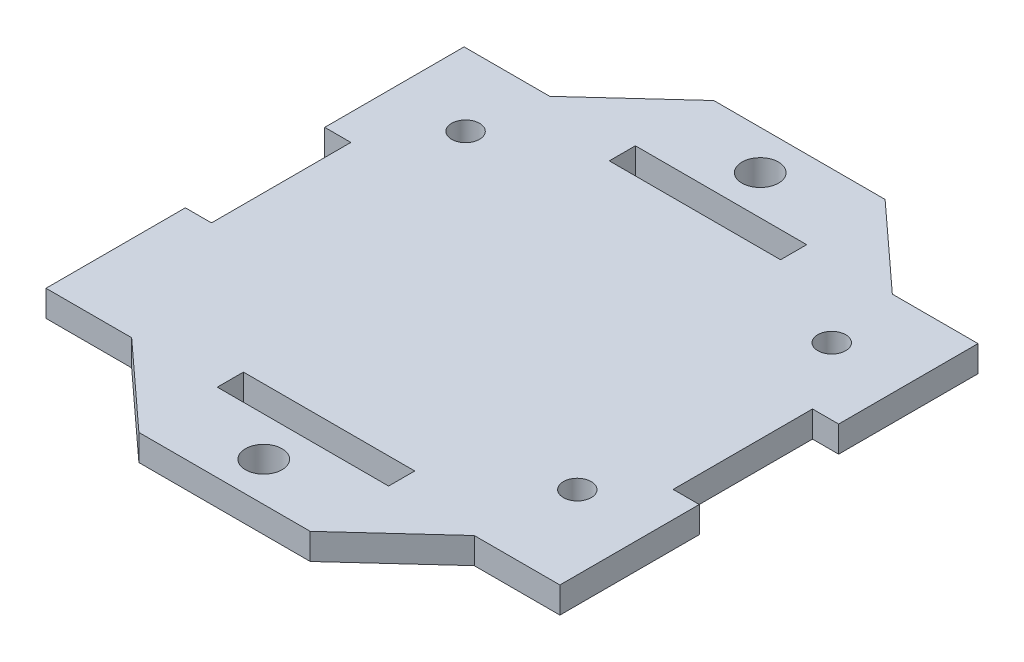
from build123d import *

# Parameters (mm, degrees)
SKETCH1_R           = 1.6
BOSS_EXTRUDE1_DEPTH = 3
SKETCH2_R           = 2.1
BOSS_EXTRUDE2_DEPTH = 3


with BuildPart() as part:
    # Sketch1 → Boss-Extrude1 (new body)
    with BuildSketch(Plane(origin=(0, 0, 0), x_dir=(1, 0, 0), z_dir=(0, 1, 0))):
        Polygon((-29.5, 24), (-29.5, 8), (-26.5, 8), (-26.5, -8), (-29.5, -8), (-29.5, -24), (-9.833333333, -24), (-9.833333333, -21), (9.833333333, -21), (9.833333333, -24), (29.5, -24), (29.5, -8), (26.5, -8), (26.5, 8), (29.5, 8), (29.5, 24), (9.833333333, 24), (9.833333333, 21), (-9.833333333, 21), (-9.833333333, 24), align=None)
        with Locations((-21.0185, 15.69)):
            Circle(SKETCH1_R, mode=Mode.SUBTRACT)
        with Locations((21.0185, 15.69)):
            Circle(SKETCH1_R, mode=Mode.SUBTRACT)
        with Locations((21.0185, -13.52)):
            Circle(SKETCH1_R, mode=Mode.SUBTRACT)
    extrude(amount=BOSS_EXTRUDE1_DEPTH)

    # Sketch2 → Boss-Extrude2 (add)
    with BuildSketch(Plane(origin=(0, 3, 0), x_dir=(1, 0, 0), z_dir=(0, 1, 0))):
        Polygon((-19.666666667, 24), (-9.833333333, 33), (9.833333333, 33), (19.666666667, 24), align=None)
        with Locations((0, 28.5)):
            Circle(SKETCH2_R, mode=Mode.SUBTRACT)
    boss_extrude2 = extrude(amount=-BOSS_EXTRUDE2_DEPTH)

    # Mirror1: Boss-Extrude2 across plane
    add(boss_extrude2.mirror(Plane.XY))


solid = part.part
